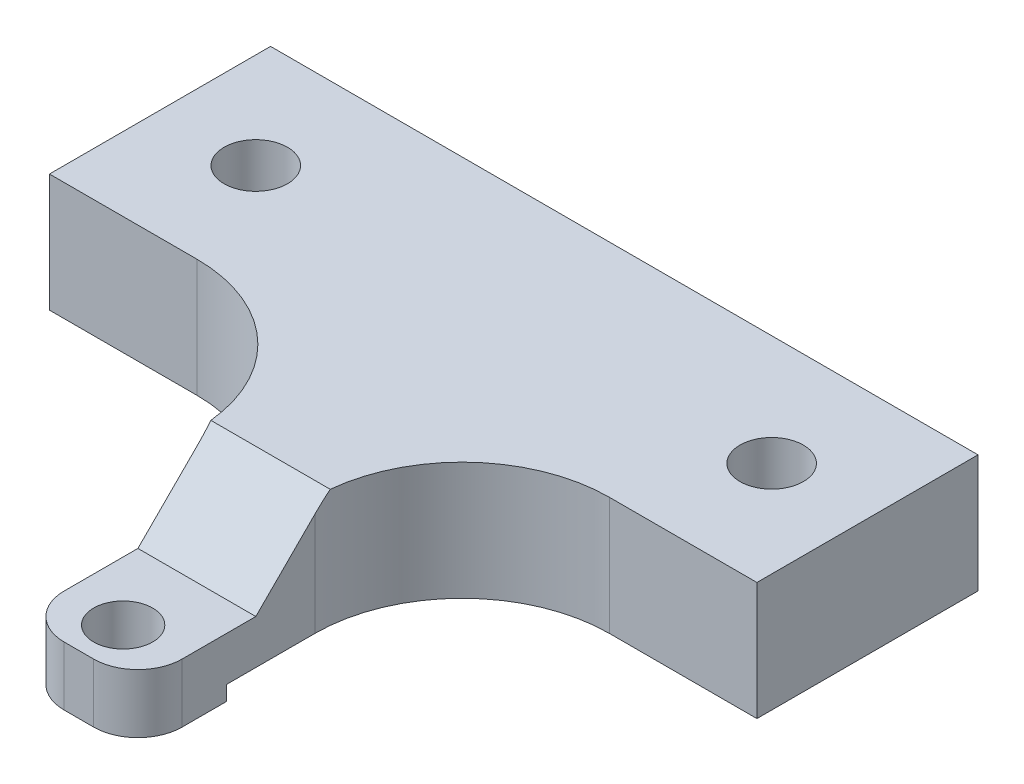
from build123d import *

# Parameters (mm, degrees)
SKETCH_1_W                   = 48
SKETCH_1_H                   = 37
EXTRUDE_1_DEPTH              = 8
SKETCH_2_W                   = 20
SKETCH_2_H                   = 22
CUT_EXTRUDE_1_DEPTH          = 32.340867888
FILLET_1_R                   = 10
SKETCH_3_W                   = 8
SKETCH_3_H                   = 6
EXTRUDE_2_DEPTH              = 1
SKETCH_4_R                   = 2
CUT_EXTRUDE_2_DEPTH          = 32.610915836
HOLE_WIZARD_M4_1_D           = 4.3
HOLE_WIZARD_M4_1_CBORE_D     = 8
HOLE_WIZARD_M4_1_CBORE_DEPTH = 4.4
SKETCH_7_W                   = 8
SKETCH_7_H                   = 8
CUT_EXTRUDE_3_DEPTH          = 5
CHAMFER_1_SIZE               = 5
FILLET_2_R                   = 3


with BuildPart() as part:
    # 草图1 → 凸台-拉伸1 (new body)
    with BuildSketch(Plane(origin=(0, 0, 0), x_dir=(1, 0, 0), z_dir=(0, 1, 0))):
        Rectangle(SKETCH_1_W, SKETCH_1_H)
    extrude(amount=EXTRUDE_1_DEPTH)

    # 草图2 → 切除-拉伸1 (cut, through all)
    with BuildSketch(Plane(origin=(0, 8, 0), x_dir=(1, 0, 0), z_dir=(0, 1, 0))):
        with Locations((-14, -7.5)):
            Rectangle(SKETCH_2_W, SKETCH_2_H)
        with Locations((14, -7.5)):
            Rectangle(SKETCH_2_W, SKETCH_2_H)
    extrude(amount=-CUT_EXTRUDE_1_DEPTH, mode=Mode.SUBTRACT)

    # 圆角1
    fillet_1_edges = [part.edges().sort_by_distance(p)[0] for p in [
        (-4, 4, -3.5),
        (4, 4, -3.5),
    ]]
    fillet(fillet_1_edges, radius=FILLET_1_R)

    # 草图3 → 凸台-拉伸2 (add)
    with BuildSketch(Plane.XZ):
        with Locations((0, 15.5)):
            Rectangle(SKETCH_3_W, SKETCH_3_H)
    extrude(amount=EXTRUDE_2_DEPTH)

    # 草图4 → 切除-拉伸2 (cut, through all)
    with BuildSketch(Plane(origin=(0, 8, 0), x_dir=(1, 0, 0), z_dir=(0, 1, 0))):
        with Locations(Location((0, -15.5, 0), (0, 0, 270))):
            Circle(SKETCH_4_R)
    extrude(amount=-CUT_EXTRUDE_2_DEPTH, mode=Mode.SUBTRACT)

    # M4 六角凹头螺钉的柱形沉头孔1 (through all)
    with Locations(Plane(origin=(17.5, 0, -11), x_dir=(0, 0, -1), z_dir=(0, -1, 0))):
        with Locations((0, 0), (0, -35)):
            CounterBoreHole(HOLE_WIZARD_M4_1_D / 2, HOLE_WIZARD_M4_1_CBORE_D / 2, HOLE_WIZARD_M4_1_CBORE_DEPTH)

    # 草图7 → 切除-拉伸3 (cut)
    with BuildSketch(Plane(origin=(0, 8, 0), x_dir=(1, 0, 0), z_dir=(0, 1, 0))):
        with Locations((0, -14.5)):
            Rectangle(SKETCH_7_W, SKETCH_7_H)
    extrude(amount=-CUT_EXTRUDE_3_DEPTH, mode=Mode.SUBTRACT)

    # 倒角1
    chamfer_1_edges = [part.edges().sort_by_distance(p)[0] for p in [
        (0, 8, 10.5),
    ]]
    chamfer(chamfer_1_edges, length=CHAMFER_1_SIZE - 0.0001)  # a hair under: the kernel refuses the full size

    # 圆角2
    fillet_2_edges = [part.edges().sort_by_distance(p)[0] for p in [
        (-4, 1, 18.5),
        (4, 1, 18.5),
    ]]
    fillet(fillet_2_edges, radius=FILLET_2_R)


solid = part.part
